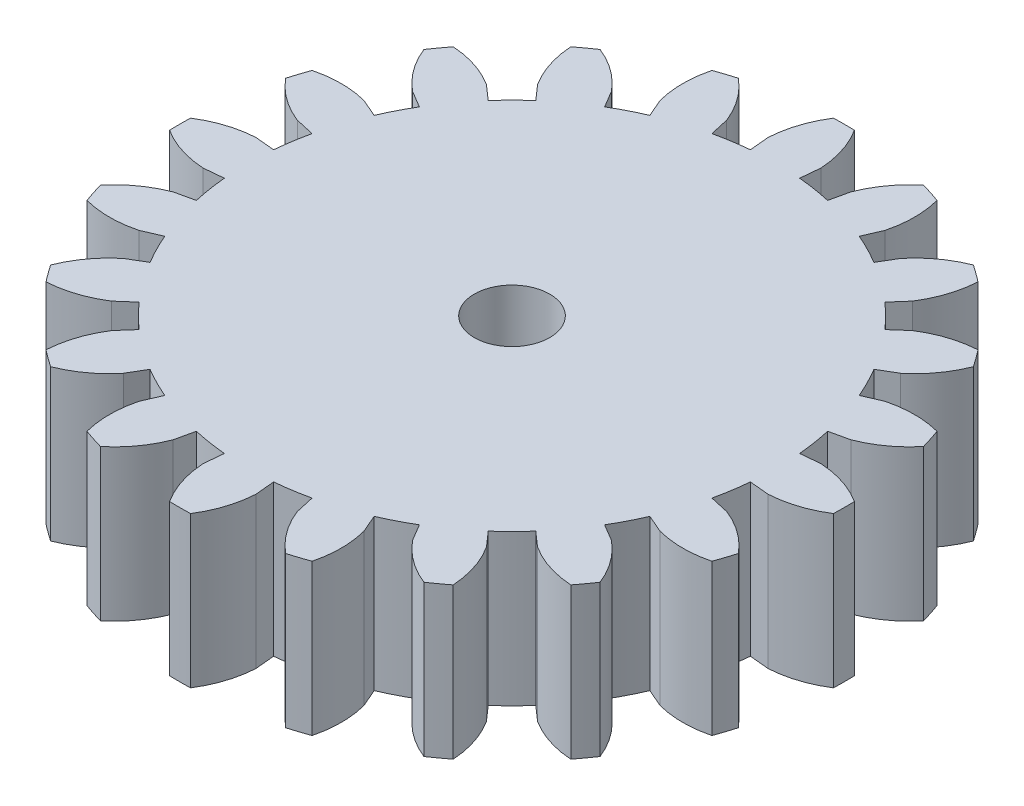
from build123d import *

# Parameters (mm, degrees)
SKETCH_1_R               = 17.5
EXTRUDE_1_DEPTH          = 10
EXTRUDE_2_DEPTH          = 10
PATTERN_CIRCULAR_1_COUNT = 20
SKETCH_3_R               = 2.5
CUT_EXTRUDE_1_DEPTH      = 33.680269277


with BuildPart() as part:
    # Эскиз1 → Бобышка-Вытянуть1 (new body)
    with BuildSketch(Plane(origin=(0, 0, 0), x_dir=(1, 0, 0), z_dir=(0, 1, 0))):
        Circle(SKETCH_1_R)
    extrude(amount=EXTRUDE_1_DEPTH)

    # Эскиз2 → Бобышка-Вытянуть2 (add)
    with BuildSketch(Plane.XZ):
        with BuildLine():
            Line((-1.631691003, 17.423764934), (-1.752328912, 18.711978549))
            ThreePointArc((-1.752328912, 18.711978549), (-1.433460227, 20.418219236), (-0.694874519, 21.989023384))
            ThreePointArc((-0.694874519, 21.989023384), (0, 22), (0.694874519, 21.989023384))
            ThreePointArc((0.694874519, 21.989023384), (1.433460227, 20.418219236), (1.752328912, 18.711978549))
            Line((1.752328912, 18.711978549), (1.631691003, 17.423764934))
            ThreePointArc((1.631691003, 17.423764934), (0, 17.5), (-1.631691003, 17.423764934))
        make_face()
    extrude_2 = extrude(amount=-EXTRUDE_2_DEPTH)

    # Круговой массив1: Бобышка-Вытянуть2 ×20 about axis
    pattern_circular_1_axis = Axis((0, 10, 0), (0, -1, 0))
    for i in range(1, PATTERN_CIRCULAR_1_COUNT):
        add(extrude_2.rotate(pattern_circular_1_axis, i * 360 / PATTERN_CIRCULAR_1_COUNT))

    # Эскиз3 → Вырез-Вытянуть1 (cut, through all)
    with BuildSketch(Plane.XZ):
        Circle(SKETCH_3_R)
    extrude(amount=-CUT_EXTRUDE_1_DEPTH, mode=Mode.SUBTRACT)


solid = part.part
